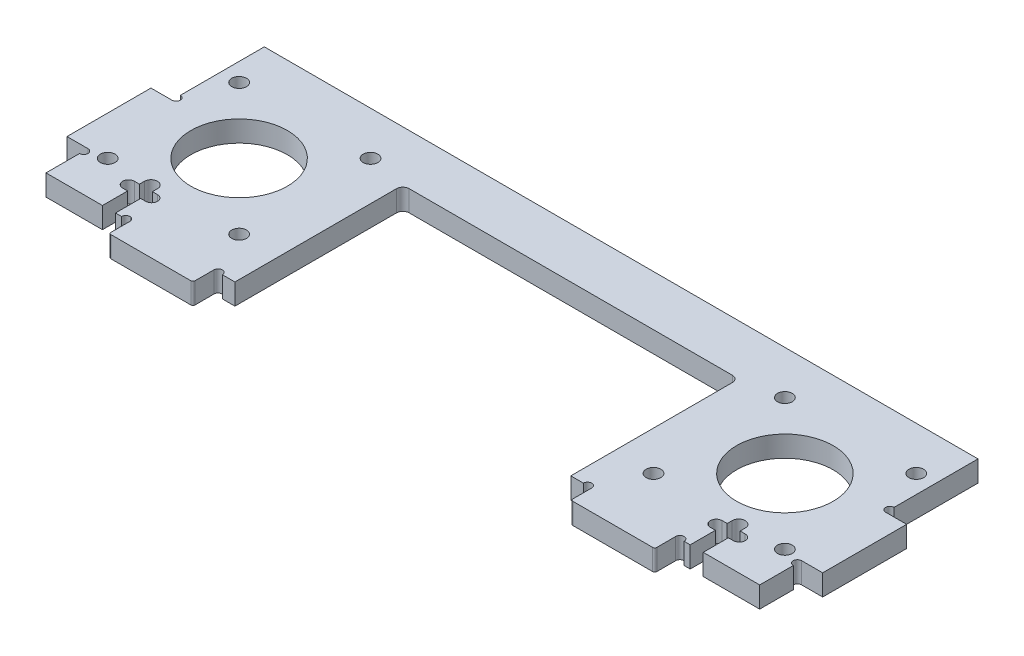
from build123d import *

# Parameters (mm, degrees)
SKETCH_1_W          = 170
SKETCH_1_H          = 52
EXTRUDE_1_DEPTH     = 5
SKETCH_2_R          = 11.5
SKETCH_2_R_2        = 1.75
CUT_EXTRUDE_1_DEPTH = 5
SKETCH_3_W          = 20
SKETCH_3_H          = 5
EXTRUDE_2_DEPTH     = 5
SKETCH_4_R          = 1
CUT_EXTRUDE_2_DEPTH = 5
CUT_EXTRUDE_3_DEPTH = 10
FILLET_1_R          = 0.5
SKETCH_7_W          = 5
SKETCH_7_H          = 20
EXTRUDE_3_DEPTH     = 5
SKETCH_8_R          = 1
CUT_EXTRUDE_5_DEPTH = 5
SKETCH_9_W          = 80
SKETCH_9_H          = 40
CUT_EXTRUDE_6_DEPTH = 10
FILLET_2_R          = 1.5


with BuildPart() as part:
    # 스케치1 → 보스-돌출1 (new body)
    with BuildSketch(Plane(origin=(0, 0, 0), x_dir=(1, 0, 0), z_dir=(0, 1, 0))):
        with Locations((85, 26)):
            Rectangle(SKETCH_1_W, SKETCH_1_H)
    extrude(amount=EXTRUDE_1_DEPTH)

    # 스케치2 → 컷-돌출1 (cut)
    with BuildSketch(Plane(origin=(0, 5, 0), x_dir=(1, 0, 0), z_dir=(0, 1, 0))):
        with Locations((150, 26)):
            Circle(SKETCH_2_R)
        with Locations((165.65, 41.65)):
            Circle(SKETCH_2_R_2)
        with Locations((134.35, 41.65)):
            Circle(SKETCH_2_R_2)
        with Locations((165.65, 10.35)):
            Circle(SKETCH_2_R_2)
        with Locations((134.35, 10.35)):
            Circle(SKETCH_2_R_2)
        with Locations((35.65, 10.35)):
            Circle(SKETCH_2_R_2)
        with Locations((4.35, 10.35)):
            Circle(SKETCH_2_R_2)
        with Locations((35.65, 41.65)):
            Circle(SKETCH_2_R_2)
        with Locations((4.35, 41.65)):
            Circle(SKETCH_2_R_2)
        with Locations((20, 26)):
            Circle(SKETCH_2_R)
    extrude(amount=-CUT_EXTRUDE_1_DEPTH, mode=Mode.SUBTRACT)

    # 스케치3 → 보스-돌출2 (add)
    with BuildSketch(Plane(origin=(0, 5, 0), x_dir=(1, 0, 0), z_dir=(0, 1, 0))):
        with Locations((140, -2.5)):
            Rectangle(SKETCH_3_W, SKETCH_3_H)
        with Locations((30, -2.5)):
            Rectangle(SKETCH_3_W, SKETCH_3_H)
    extrude(amount=-EXTRUDE_2_DEPTH)

    # 스케치4 → 컷-돌출2 (cut)
    with BuildSketch(Plane(origin=(0, 5, 0), x_dir=(1, 0, 0), z_dir=(0, 1, 0))):
        with Locations((129, 0)):
            Circle(SKETCH_4_R)
        with Locations((151, 0)):
            Circle(SKETCH_4_R)
        with Locations((19, 0)):
            Circle(SKETCH_4_R)
        with Locations((41, 0)):
            Circle(SKETCH_4_R)
    extrude(amount=-CUT_EXTRUDE_2_DEPTH, mode=Mode.SUBTRACT)

    # 스케치5 → 컷-돌출3 (cut)
    with BuildSketch(Plane(origin=(0, 5, 0), x_dir=(1, 0, 0), z_dir=(0, 1, 0))):
        with BuildLine():
            Line((156.55, 0), (156.55, 6))
            Line((156.55, 6), (157.75, 6))
            ThreePointArc((157.75, 6), (159.15, 7.4), (157.75, 8.8))
            Line((157.75, 8.8), (156.55, 8.8))
            Line((156.55, 8.8), (156.55, 10))
            ThreePointArc((156.55, 10), (155, 11.55), (153.45, 10))
            Line((153.45, 10), (153.45, 8.8))
            Line((153.45, 8.8), (152.25, 8.8))
            ThreePointArc((152.25, 8.8), (150.85, 7.4), (152.25, 6))
            Line((152.25, 6), (153.45, 6))
            Line((153.45, 6), (153.45, 0))
            Line((153.45, 0), (156.55, 0))
        make_face()
        with BuildLine():
            Line((12.25, 6), (13.45, 6))
            Line((13.45, 6), (13.45, 0))
            Line((13.45, 0), (16.55, 0))
            Line((16.55, 0), (16.55, 6))
            Line((16.55, 6), (17.75, 6))
            ThreePointArc((17.75, 6), (19.15, 7.4), (17.75, 8.8))
            Line((17.75, 8.8), (16.55, 8.8))
            Line((16.55, 8.8), (16.55, 10))
            ThreePointArc((16.55, 10), (15, 11.55), (13.45, 10))
            Line((13.45, 10), (13.45, 8.8))
            Line((13.45, 8.8), (12.25, 8.8))
            ThreePointArc((12.25, 8.8), (10.85, 7.4), (12.25, 6))
        make_face()
    extrude(amount=-CUT_EXTRUDE_3_DEPTH, mode=Mode.SUBTRACT)

    # 필렛1
    fillet_1_edges = [part.edges().sort_by_distance(p)[0] for p in [
        (20, 2.5, 5),
        (130, 2.5, 5),
        (150, 2.5, 5),
        (40, 2.5, 5),
    ]]
    fillet(fillet_1_edges, radius=FILLET_1_R)

    # 스케치7 → 보스-돌출3 (add)
    with BuildSketch(Plane(origin=(0, 5, 0), x_dir=(1, 0, 0), z_dir=(0, 1, 0))):
        with Locations((172.5, 20)):
            Rectangle(SKETCH_7_W, SKETCH_7_H)
        with Locations((-2.5, 20)):
            Rectangle(SKETCH_7_W, SKETCH_7_H)
    extrude(amount=-EXTRUDE_3_DEPTH)

    # 스케치8 → 컷-돌출5 (cut)
    with BuildSketch(Plane(origin=(0, 5, 0), x_dir=(1, 0, 0), z_dir=(0, 1, 0))):
        with Locations((170, 9)):
            Circle(SKETCH_8_R)
        with Locations((170, 31)):
            Circle(SKETCH_8_R)
        with Locations((0, 9)):
            Circle(SKETCH_8_R)
        with Locations((0, 31)):
            Circle(SKETCH_8_R)
    extrude(amount=-CUT_EXTRUDE_5_DEPTH, mode=Mode.SUBTRACT)

    # 스케치9 → 컷-돌출6 (cut)
    with BuildSketch(Plane(origin=(0, 5, 0), x_dir=(1, 0, 0), z_dir=(0, 1, 0))):
        with Locations((85, 20)):
            Rectangle(SKETCH_9_W, SKETCH_9_H)
    extrude(amount=-CUT_EXTRUDE_6_DEPTH, mode=Mode.SUBTRACT)

    # 필렛2
    fillet_2_edges = [part.edges().sort_by_distance(p)[0] for p in [
        (125, 2.5, -40),
        (45, 2.5, -40),
    ]]
    fillet(fillet_2_edges, radius=FILLET_2_R)


solid = part.part
